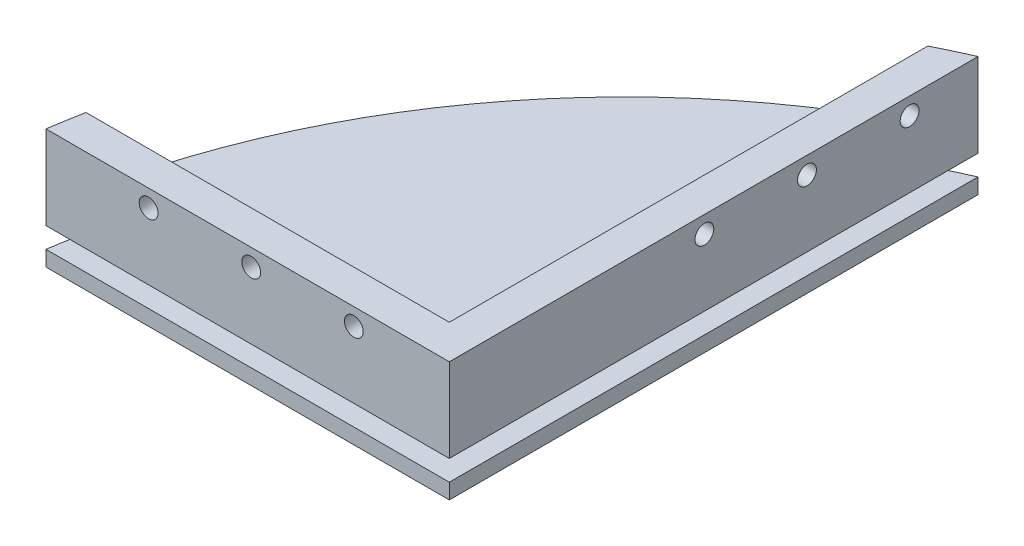
from build123d import *

# Parameters (mm, degrees)
SKETCH1_R                = 200
BOSS_EXTRUDE1_DEPTH      = 15
BOSS_EXTRUDE2_DEPTH      = 200
CUT_EXTRUDE1_DEPTH       = 286.087705803
CUT_EXTRUDE1_DEPTH_BACK  = 286.087705803
SKETCH3_R                = 85
CUT_EXTRUDE2_DEPTH       = 451.079120005
CUT_EXTRUDE2_DEPTH_BACK  = 451.079120005
SKETCH4_R                = 11
CUT_EXTRUDE3_DEPTH       = 451.079120105
CUT_EXTRUDE3_DEPTH_BACK  = 110
CUT_EXTRUDE4_DEPTH       = 110
BOSS_EXTRUDE3_DEPTH      = 200
CUT_EXTRUDE5_DEPTH       = 286.087705815
CUT_EXTRUDE5_DEPTH_BACK  = 286.087705815
SKETCH7_OUTSIDE_W        = 515.59
SKETCH7_OUTSIDE_H        = 515.59
SKETCH7_OUTSIDE_R        = 200
SKETCH9_R                = 4
BOSS_EXTRUDE4_DEPTH      = 220
CUT_EXTRUDE6_DEPTH       = 190
SKETCH11_R               = 3
CUT_EXTRUDE7_DEPTH       = 486.974499745
CUT_EXTRUDE8_DEPTH       = 300.457843596
CUT_EXTRUDE8_DEPTH_BACK  = 300.457843596
SKETCH12_OUTSIDE_W       = 561.36
SKETCH12_OUTSIDE_H       = 521.36
BOSS_EXTRUDE5_DEPTH      = 160
CUT_EXTRUDE12_DEPTH      = 257.904651573
CUT_EXTRUDE12_DEPTH_BACK = 257.904651573
SKETCH15_W               = 10
SKETCH15_H               = 6
SKETCH16_W               = 10
SKETCH16_H               = 6
CUT_EXTRUDE13_DEPTH      = 160
BOSS_EXTRUDE6_DEPTH      = 160
CUT_EXTRUDE11_DEPTH      = 20
SKETCH18_R               = 2.75
CUT_EXTRUDE14_DEPTH      = 221.752620232
SKETCH19_R               = 2.75
CUT_EXTRUDE15_DEPTH      = 10


# Read off the part's stored shape, not the designer's step: Cut-Extrude11
with BuildPart() as part:
    # Sketch1 → Boss-Extrude1 (new body)
    with BuildSketch(Plane(origin=(0, 0, 0), x_dir=(1, 0, 0), z_dir=(0, 1, 0))):
        with Locations(Location((0, 0, 0), (0, 0, 270))):
            Circle(SKETCH1_R)
    extrude(amount=BOSS_EXTRUDE1_DEPTH)

    # Sketch2 → Boss-Extrude2 (add, symmetric)
    with BuildSketch(Plane.XY):
        Polygon((-25, 50.707142143), (25, 50.707142143), (60, 15), (-60, 15), align=None)
    extrude(amount=BOSS_EXTRUDE2_DEPTH, both=True)

    # Sketch3 → Cut-Extrude1 (cut, two sides: drawn at the far end of the back side and taken through both)
    with BuildSketch(Plane(origin=(0, 15, 0), x_dir=(1, 0, 0), z_dir=(0, 1, 0)).offset(-CUT_EXTRUDE1_DEPTH_BACK)):
        with Locations(Location((0, 0, 0), (0, 0, 270))):
            Circle(SKETCH3_R)
    extrude(amount=CUT_EXTRUDE1_DEPTH + CUT_EXTRUDE1_DEPTH_BACK, mode=Mode.SUBTRACT)

    # Sketch4 → Cut-Extrude2 (cut, two sides: drawn at the far end of the back side and taken through both)
    with BuildSketch(Plane(origin=(0, 0, -200), x_dir=(-1, 0, 0), z_dir=(0, 0, -1)).offset(-CUT_EXTRUDE2_DEPTH_BACK)):
        with Locations((0, 29)):
            Circle(SKETCH4_R)
    extrude(amount=CUT_EXTRUDE2_DEPTH + CUT_EXTRUDE2_DEPTH_BACK, mode=Mode.SUBTRACT)

    # Sketch5 → Cut-Extrude3 (cut, two sides: drawn at the far end of the back side and taken through both)
    with BuildSketch(Plane.XY.offset(200).offset(-CUT_EXTRUDE3_DEPTH_BACK)):
        Polygon((-25, 50.707142143), (25, 50.707142143), (50.198039412, 25), (25, 25), (25, 15), (-25, 15), (-25, 25), (-50.198039412, 25), align=None)
    extrude(amount=CUT_EXTRUDE3_DEPTH + CUT_EXTRUDE3_DEPTH_BACK, mode=Mode.SUBTRACT)

    # Sketch6 → Cut-Extrude4 (cut)
    with BuildSketch(Plane(origin=(0, 0, -200), x_dir=(-1, 0, 0), z_dir=(0, 0, -1))):
        Polygon((-25, 50.707142143), (25, 50.707142143), (50.198039412, 25), (25, 25), (25, 15), (-25, 15), (-25, 25), (-50.198039412, 25), align=None)
    extrude(amount=-CUT_EXTRUDE4_DEPTH, mode=Mode.SUBTRACT)

    # Sketch8 → Boss-Extrude3 (add, symmetric)
    with BuildSketch(Plane(origin=(0, 0, 0), x_dir=(0, 0, -1), z_dir=(1, 0, 0))):
        Polygon((0, 15), (-20, 15), (-10, 35.712315177), (10, 35.712315177), (20, 15), align=None)
    extrude(amount=BOSS_EXTRUDE3_DEPTH, both=True)

    # Sketch7 outside → Cut-Extrude5 (cut, two sides: drawn at the far end of the back side and taken through both)
    with BuildSketch(Plane(origin=(0, 15, 0), x_dir=(1, 0, 0), z_dir=(0, 1, 0)).offset(-CUT_EXTRUDE5_DEPTH_BACK)):
        Rectangle(SKETCH7_OUTSIDE_W, SKETCH7_OUTSIDE_H)
        with Locations(Location((0, 0, 0), (0, 0, 97.180755781))):
            Circle(SKETCH7_OUTSIDE_R, mode=Mode.SUBTRACT)
    extrude(amount=CUT_EXTRUDE5_DEPTH + CUT_EXTRUDE5_DEPTH_BACK, mode=Mode.SUBTRACT)

    # Sketch9 → Boss-Extrude4 (add, symmetric)
    with BuildSketch(Plane(origin=(0, 0, 0), x_dir=(0, 0, -1), z_dir=(1, 0, 0))):
        with Locations(Location((0, 29, 0), (0, 0, 180))):
            Circle(SKETCH9_R)
    extrude(amount=BOSS_EXTRUDE4_DEPTH, both=True)

    # Sketch10 → Cut-Extrude6 (cut, symmetric)
    with BuildSketch(Plane(origin=(0, 0, 0), x_dir=(0, 0, -1), z_dir=(1, 0, 0))):
        Polygon((-20, 15), (20, 15), (10, 35.712315177), (-10, 35.712315177), align=None)
    extrude(amount=CUT_EXTRUDE6_DEPTH, both=True, mode=Mode.SUBTRACT)

    # Sketch11 → Cut-Extrude7 (cut, through all)
    with BuildSketch(Plane.ZY.offset(220)):
        with Locations((0, 29)):
            Circle(SKETCH11_R)
    extrude(amount=-CUT_EXTRUDE7_DEPTH, mode=Mode.SUBTRACT)

    # Sketch12 outside → Cut-Extrude8 (cut, two sides: drawn at the far end of the back side and taken through both)
    with BuildSketch(Plane(origin=(0, 15, 0), x_dir=(1, 0, 0), z_dir=(0, 1, 0)).offset(-CUT_EXTRUDE8_DEPTH_BACK)):
        Rectangle(SKETCH12_OUTSIDE_W, SKETCH12_OUTSIDE_H)
        Polygon((-80, 28.722813233), (-80, 204.186648187), (-238.714560715, 172.391160391), (-238.714560715, 28.722813233), align=None, mode=Mode.SUBTRACT)
    extrude(amount=CUT_EXTRUDE8_DEPTH + CUT_EXTRUDE8_DEPTH_BACK, mode=Mode.SUBTRACT)

    # Sketch13 → Boss-Extrude5 (add)
    with BuildSketch(Plane.XY.offset(-28.722813233)):
        Polygon((-80, 15), (-80, 35), (-90, 35), (-90, 25), (-99.19, 15), align=None)
    extrude(amount=-BOSS_EXTRUDE5_DEPTH)

    # Sketch15 → Cut-Extrude12 (cut, two sides: drawn at the far end of the back side and taken through both)
    with BuildSketch(Plane.XY.offset(-28.722813233).offset(-CUT_EXTRUDE12_DEPTH_BACK)):
        with Locations((-85, 7.5)):
            Rectangle(SKETCH15_W, SKETCH15_H)
    extrude(amount=CUT_EXTRUDE12_DEPTH + CUT_EXTRUDE12_DEPTH_BACK, mode=Mode.SUBTRACT)

    # Sketch16 → Cut-Extrude13 (cut)
    with BuildSketch(Plane(origin=(-90, 0, 0), x_dir=(0, 0, -1), z_dir=(1, 0, 0))):
        with Locations((33.722813233, 7.5)):
            Rectangle(SKETCH16_W, SKETCH16_H)
    extrude(amount=-CUT_EXTRUDE13_DEPTH, mode=Mode.SUBTRACT)

    # Sketch17 → Boss-Extrude6 (add)
    with BuildSketch(Plane.ZY.offset(90)):
        Polygon((-28.722813233, 15), (-28.722813233, 35), (-38.722813233, 35), (-38.722813233, 25), (-47.912813233, 15), align=None)
    extrude(amount=BOSS_EXTRUDE6_DEPTH)

    # Cut-Extrude11 outline → Cut-Extrude11 (cut)
    with BuildSketch(Plane(origin=(0, 15, 0), x_dir=(1, 0, 0), z_dir=(0, 1, 0))):
        with BuildLine():
            Line((-250, 28.722813233), (-197.926754129, 28.722813233))
            ThreePointArc((-197.926754129, 28.722813233), (-159.011260133, 121.307127371), (-80, 183.303027798))
            Line((-80, 183.303027798), (-78, 184.175899359))
            Line((-78, 184.175899359), (-78, 188.722813233))
            Line((-78, 188.722813233), (-250, 188.722813233))
            Line((-250, 188.722813233), (-250, 28.722813233))
        make_face()
    extrude(amount=CUT_EXTRUDE11_DEPTH, mode=Mode.SUBTRACT)

    # Sketch18 → Cut-Extrude14 (cut, through all)
    with BuildSketch(Plane(origin=(-80, 0, 0), x_dir=(0, 0, -1), z_dir=(1, 0, 0))):
        with Locations((103.303027798, 30)):
            Circle(SKETCH18_R)
        with Locations((133.303027798, 30)):
            Circle(SKETCH18_R)
        with Locations((163.303027798, 30)):
            Circle(SKETCH18_R)
    extrude(amount=-CUT_EXTRUDE14_DEPTH, mode=Mode.SUBTRACT)

    # Sketch19 → Cut-Extrude15 (cut)
    with BuildSketch(Plane.XY.offset(-28.722813233)):
        with Locations((-167.926754129, 30)):
            Circle(SKETCH19_R)
        with Locations((-107.926754129, 30)):
            Circle(SKETCH19_R)
        with Locations((-137.926754129, 30)):
            Circle(SKETCH19_R)
    extrude(amount=-CUT_EXTRUDE15_DEPTH, mode=Mode.SUBTRACT)


solid = part.part
